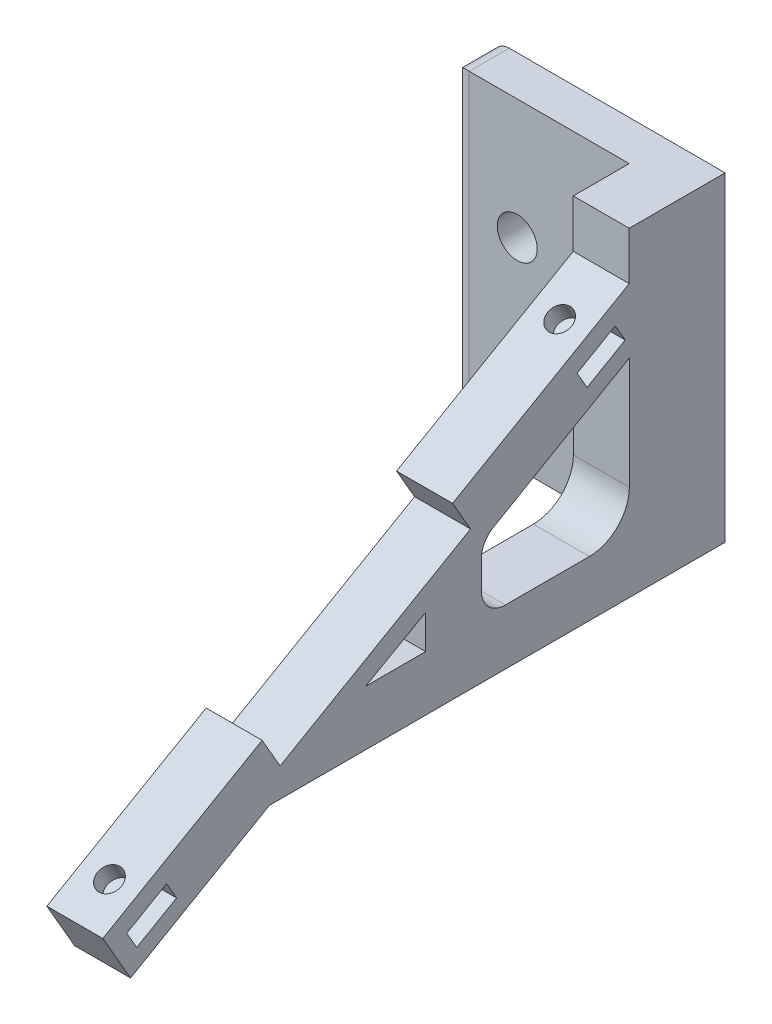
from build123d import *

# Parameters (mm, degrees)
BOSS_EXTRUDE1_DEPTH = 7
SKETCH2_W           = 29
SKETCH2_H           = 40
SKETCH2_R           = 2.5
BOSS_EXTRUDE2_DEPTH = 5
FILLET1_R           = 2
SKETCH3_R           = 1.5
CUT_EXTRUDE1_DEPTH  = 7.5


with BuildPart() as part:
    # Sketch1 → Boss-Extrude1 (new body)
    with BuildSketch(Plane(origin=(0, 0, 0), x_dir=(0, 0, -1), z_dir=(1, 0, 0))):
        Polygon((0, 0), (0, 40), (-7, 40), (-7, 34), (-29.083647797, 21.25), (-26.833647797, 17.352885683), (-50.649346401, 3.602885683), (-52.899346401, 7.5), (-72.817930688, -4), (-69.345498823, -10.014428415), (-52, 0), align=None)
        Polygon((-69.828328815, -4.926142338), (-64.848682743, -2.051142338), (-63.598682743, -4.216205848), (-68.578328815, -7.091205848), align=None, mode=Mode.SUBTRACT)
        Polygon((-39.949930688, 6.884), (-32.449930688, 11.134), (-32.449930688, 6.884), align=None, mode=Mode.SUBTRACT)
        with BuildLine():
            Line((-6.98, 25.947), (-6.98, 11.947))
            ThreePointArc((-6.98, 11.947), (-8.444466094, 8.411466094), (-11.98, 6.947))
            Line((-11.98, 6.947), (-22.48, 6.947))
            ThreePointArc((-22.48, 6.947), (-24.601320344, 7.825679656), (-25.48, 9.947))
            Line((-25.48, 9.947), (-25.48, 13.505607896))
            ThreePointArc((-25.48, 13.505607896), (-25.078135635, 15.007043949), (-23.98, 16.107))
            Line((-23.98, 16.107), (-6.98, 25.947))
        make_face(mode=Mode.SUBTRACT)
        Polygon((-13.512490144, 27.556681889), (-8.752389988, 30.311939862), (-7.5, 28.148257973), (-12.260100157, 25.393), align=None, mode=Mode.SUBTRACT)
    extrude(amount=-BOSS_EXTRUDE1_DEPTH)

    # Sketch2 → Boss-Extrude2 (add)
    with BuildSketch(Plane(origin=(0, 0, 0), x_dir=(-1, 0, 0), z_dir=(0, 0, -1))):
        with Locations((14.5, 20)):
            Rectangle(SKETCH2_W, SKETCH2_H)
        with Locations((21, 25)):
            Circle(SKETCH2_R, mode=Mode.SUBTRACT)
        with Locations((21, 5)):
            Circle(SKETCH2_R, mode=Mode.SUBTRACT)
    extrude(amount=BOSS_EXTRUDE2_DEPTH)

    # Fillet1
    fillet1_edges = [part.edges().sort_by_distance(p)[0] for p in [
        (-29, 0, -2.5),
        (-29, 20, 0),
        (-29, 40, -2.5),
    ]]
    fillet(fillet1_edges, radius=FILLET1_R)

    # Sketch3 → Cut-Extrude1 (cut)
    with BuildSketch(Plane(origin=(0, 28.531088913, 16.472431864), x_dir=(1, 0, 0), z_dir=(0, 0.8660254037844386, 0.4999999999999999))):
        with Locations((-3.5, 4.937822174)):
            Circle(SKETCH3_R)
        with Locations((-3.5, -60.062177826)):
            Circle(SKETCH3_R)
    extrude(amount=-CUT_EXTRUDE1_DEPTH, mode=Mode.SUBTRACT)


solid = part.part
